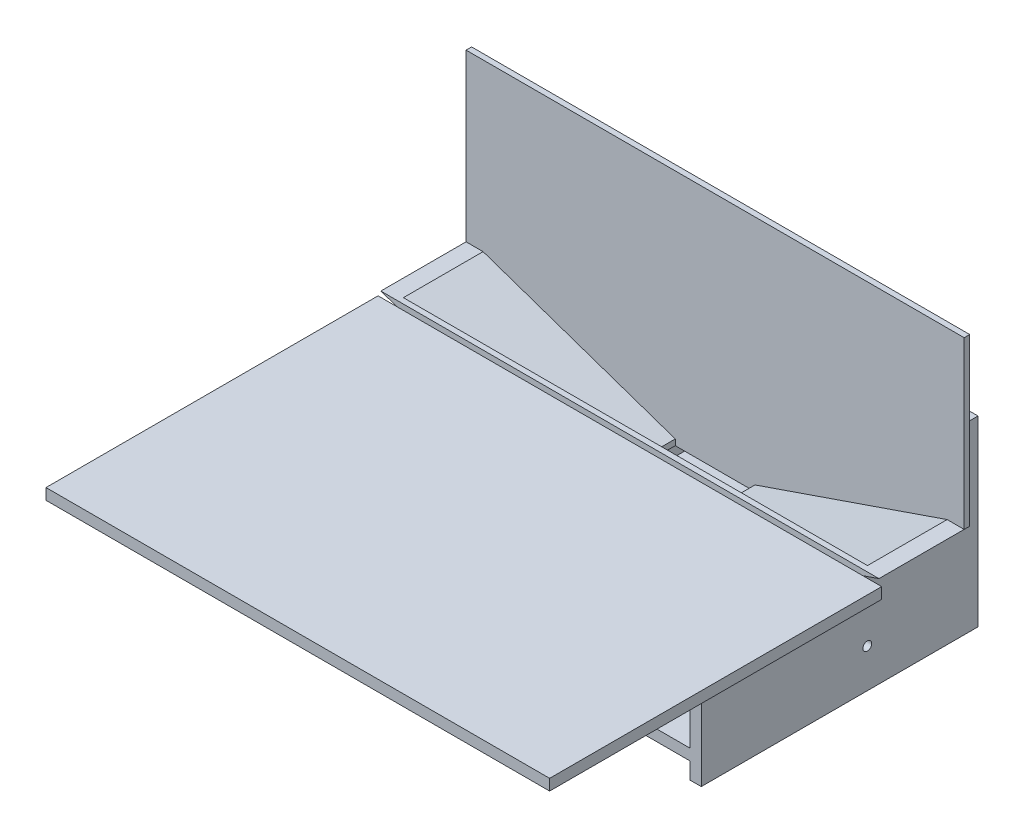
from build123d import *

# Parameters (mm, degrees)
SKETCH_4_W           = 255
SKETCH_4_H           = 250
EXTRUDE_2_DEPTH      = 10
EXTRUDE_3_DEPTH      = 140
EXTRUDE_3_DEPTH_BACK = 25
SKETCH_7_W           = 10
SKETCH_7_H           = 250
CUT_EXTRUDE_1_REACH  = 323.17
SKETCH_9_R           = 4
SKETCH_14_W          = 255
SKETCH_14_H          = 5
EXTRUDE_6_DEPTH      = 50
EXTRUDE_7_DEPTH      = 82
CUT_EXTRUDE_2_DEPTH  = 72
SKETCH_17_W          = 455
SKETCH_17_H          = 300
EXTRUDE_8_DEPTH      = 10
SKETCH_18_W          = 450
SKETCH_18_H          = 5
EXTRUDE_9_DEPTH      = 150


with BuildPart() as part:
    # 草圖4 → 填料-伸長2 (new body)
    with BuildSketch(Plane(origin=(0, 0, 0), x_dir=(1, 0, 0), z_dir=(0, 1, 0))):
        Rectangle(SKETCH_4_W, SKETCH_4_H)
    extrude(amount=EXTRUDE_2_DEPTH)

    # 草圖7 → 填料-伸長3 (add, two sides: drawn at the far end of the back side and taken through both)
    with BuildSketch(Plane(origin=(0, 10, 0), x_dir=(1, 0, 0), z_dir=(0, 1, 0)).offset(-EXTRUDE_3_DEPTH_BACK)):
        with Locations((-122.5, 0)):
            Rectangle(SKETCH_7_W, SKETCH_7_H)
        with Locations((122.5, 0)):
            Rectangle(SKETCH_7_W, SKETCH_7_H)
    extrude(amount=EXTRUDE_3_DEPTH + EXTRUDE_3_DEPTH_BACK)

    # 草圖9 → 除料-伸長1 (cut, up to next)
    with BuildSketch(Plane.ZY.offset(127.5), mode=Mode.PRIVATE) as cut_extrude_1_sk1:
        with Locations((-25, 20)):
            Circle(SKETCH_9_R)
    cut_extrude_1_tool1 = extrude(cut_extrude_1_sk1.sketch, amount=-CUT_EXTRUDE_1_REACH, mode=Mode.PRIVATE) & part.part
    cut_extrude_1 = cut_extrude_1_tool1.solids().sort_by_distance((-127.5, 20, -25))[0]
    add(cut_extrude_1, mode=Mode.SUBTRACT)

    # 鏡射1: 除料-伸長1 across plane
    add(cut_extrude_1.mirror(Plane(origin=(0, 0, 0), x_dir=(0, 0, 1), z_dir=(1, 0, 0))), mode=Mode.SUBTRACT)

    # 草圖14 → 填料-伸長6 (add)
    with BuildSketch(Plane(origin=(0, 150, 0), x_dir=(1, 0, 0), z_dir=(0, 1, 0))):
        with Locations((0, 22.5)):
            Rectangle(SKETCH_14_W, SKETCH_14_H)
    extrude(amount=-EXTRUDE_6_DEPTH)

    # 草圖15 → 填料-伸長7 (add)
    with BuildSketch(Plane.XY.offset(-20)):
        Polygon((-36, 100), (-225, 165), (225, 165), (36, 100), align=None)
    extrude(amount=EXTRUDE_7_DEPTH)

    # 草圖16 → 除料-伸長2 (cut)
    with BuildSketch(Plane.XY.offset(57)):
        Polygon((209.625772738, 165), (-209.625772738, 165), (-36, 105.287432656), (-36, 100), (36, 100), (36, 105.287432656), align=None)
    extrude(amount=-CUT_EXTRUDE_2_DEPTH, mode=Mode.SUBTRACT)

    # 草圖17 → 填料-伸長8 (add)
    with BuildSketch(Plane(origin=(0, 150, 0), x_dir=(1, 0, 0), z_dir=(0, 1, 0))):
        with Locations((0, -212)):
            Rectangle(SKETCH_17_W, SKETCH_17_H)
    extrude(amount=EXTRUDE_8_DEPTH)

    # 草圖18 → 填料-伸長9 (add)
    with BuildSketch(Plane(origin=(0, 165, 0), x_dir=(1, 0, 0), z_dir=(0, 1, 0))):
        with Locations((0, 17.5)):
            Rectangle(SKETCH_18_W, SKETCH_18_H)
    extrude(amount=EXTRUDE_9_DEPTH)


solid = part.part
